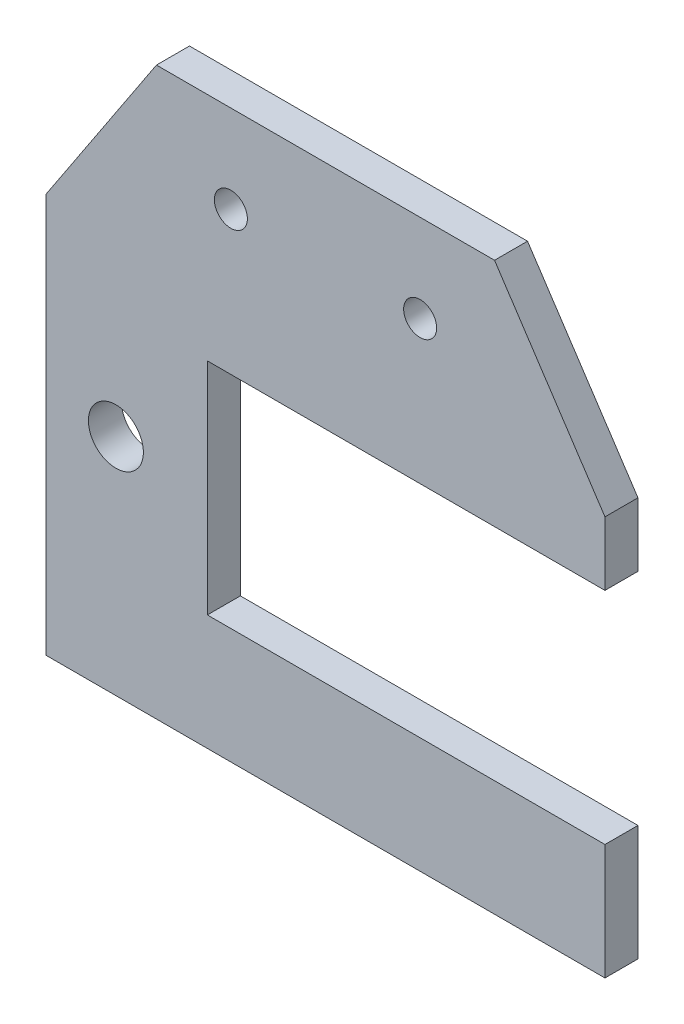
from build123d import *

# Parameters (mm, degrees)
SKETCH1_R           = 2.5
SKETCH1_R_2         = 1.5
BOSS_EXTRUDE1_DEPTH = 3


with BuildPart() as part:
    # Sketch1 → Boss-Extrude1 (new body)
    with BuildSketch(Plane.XY):
        Polygon((-25.402305243, -12.3212841), (25.402305243, -12.3212841), (25.402305243, -1.8112841), (-10.737694757, -1.8112841), (-10.737694757, 18.1887159), (25.402305243, 18.1887159), (25.402305243, 23.9787159), (15.365, 39.160695464), (-15.365, 39.160695464), (-25.402305243, 23.9787159), align=None)
        with Locations((-19.052305243, 8.0787159)):
            Circle(SKETCH1_R, mode=Mode.SUBTRACT)
        with Locations((-8.602305243, 31.190695464)):
            Circle(SKETCH1_R_2, mode=Mode.SUBTRACT)
        with Locations((8.602305243, 31.190695464)):
            Circle(SKETCH1_R_2, mode=Mode.SUBTRACT)
    extrude(amount=BOSS_EXTRUDE1_DEPTH)


solid = part.part
